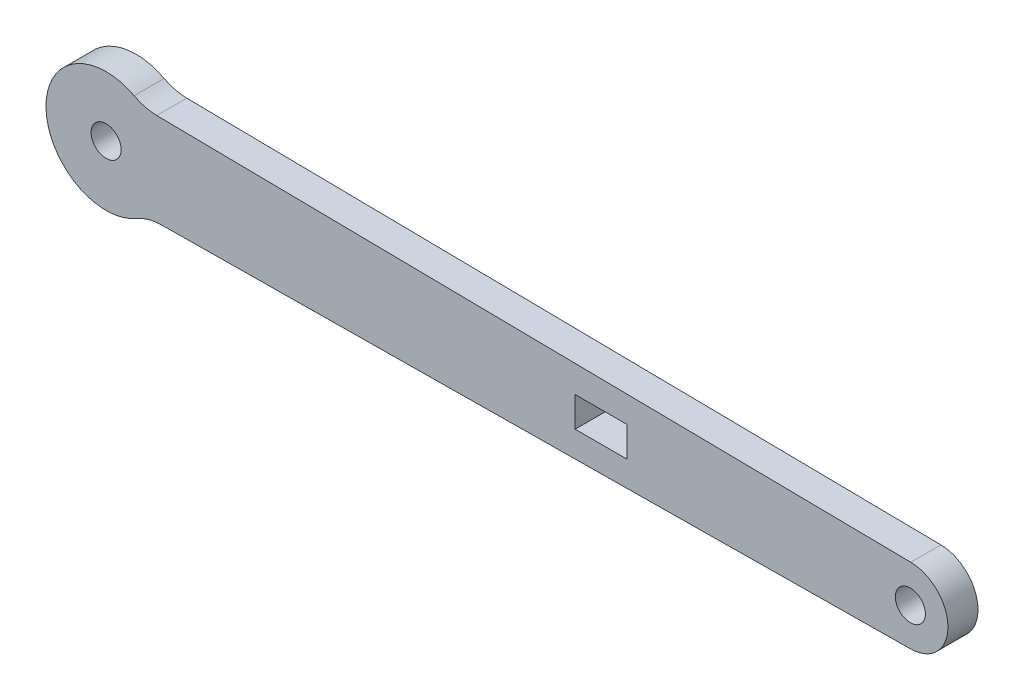
from build123d import *

# Parameters (mm, degrees)
ESQUISSE1_R               = 1.5
ESQUISSE1_W               = 5.2
ESQUISSE1_H               = 3
T_LE_DE_BASE_PLI_E1_DEPTH = 3


# Sheet-metal steps are written as plain solids
with BuildPart() as part:
    # Esquisse1 → Tôle de base pliée1 (new body)
    with BuildSketch(Plane.XY):
        with BuildLine():
            Line((14.870524532, 15.712944318), (90.111215477, 14.728402402))
            ThreePointArc((90.111215477, 14.728402402), (93.812069805, 10.954190169), (90.062150056, 7.228723404))
            Line((90.062150056, 7.228723404), (15.334764804, 6.494002243))
            ThreePointArc((15.334764804, 6.494002243), (14.047901461, 6.312443531), (12.851298677, 5.805370946))
            ThreePointArc((12.851298677, 5.805370946), (3.813779457, 10.83890154), (12.606947349, 16.288064992))
            ThreePointArc((12.606947349, 16.288064992), (13.70468529, 15.866487084), (14.870524532, 15.712944318))
        make_face()
        with Locations((9.812150056, 10.978723404)):
            Circle(ESQUISSE1_R, mode=Mode.SUBTRACT)
        with Locations((90.062150056, 10.978723404)):
            Circle(ESQUISSE1_R, mode=Mode.SUBTRACT)
        with Locations((59.212150056, 10.978723404)):
            Rectangle(ESQUISSE1_W, ESQUISSE1_H, mode=Mode.SUBTRACT)
    extrude(amount=-T_LE_DE_BASE_PLI_E1_DEPTH)


solid = part.part
